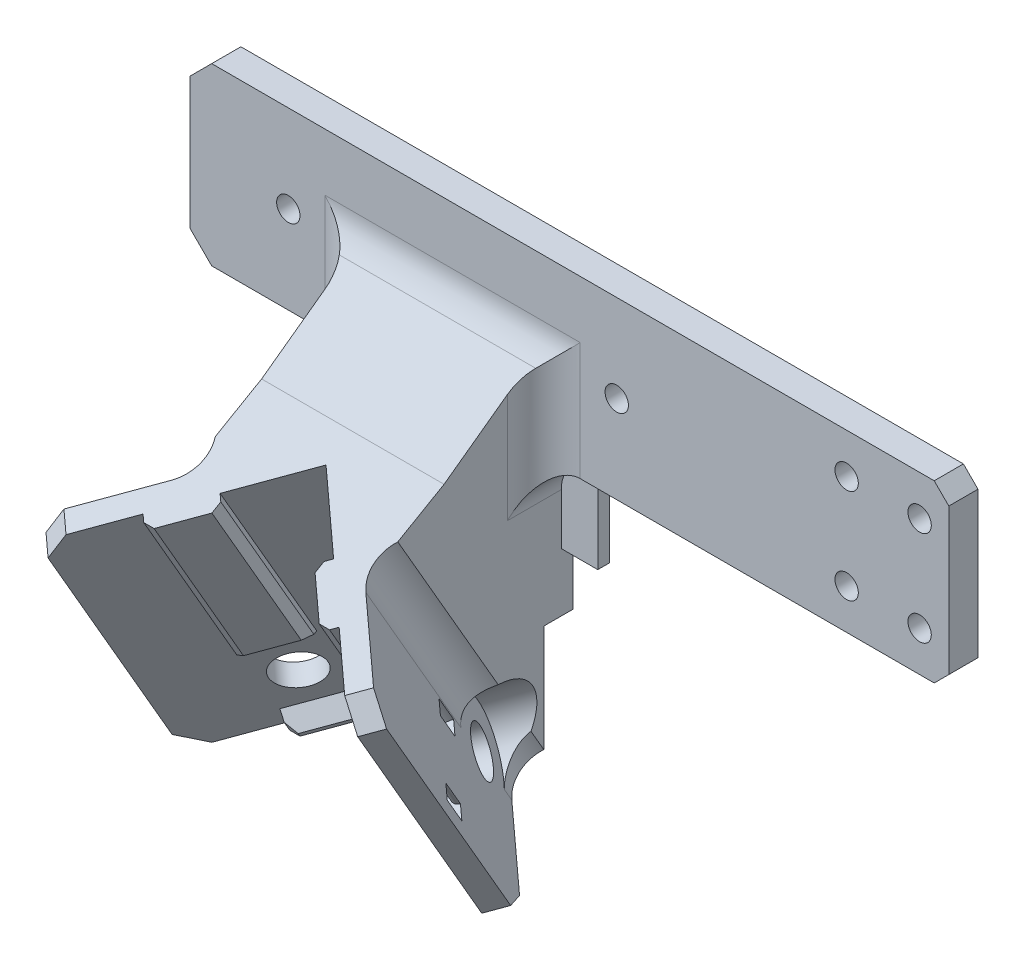
from build123d import *

# Parameters (mm, degrees)
CROQUIS1_R                   = 1.6
SALIENTE_EXTRUIR1_DEPTH      = 4
CROQUIS3_R                   = 1.6
SALIENTE_EXTRUIR3_DEPTH      = 4
SALIENTE_EXTRUIR4_DEPTH      = 10
SALIENTE_EXTRUIR4_DEPTH_BACK = 30
CROQUIS13_R                  = 3.1
CORTAR_EXTRUIR8_DEPTH        = 5
CORTAR_EXTRUIR9_DEPTH        = 2
CROQUIS15_R                  = 3.1
CORTAR_EXTRUIR10_DEPTH       = 5
CORTAR_EXTRUIR11_DEPTH       = 2
SALIENTE_EXTRUIR5_DEPTH      = 12.5
CORTAR_EXTRUIR12_DEPTH       = 97.942632989
REDONDEO1_R                  = 5
CHAFL_N1_SIZE                = 3
CROQUIS20_W                  = 35
CROQUIS20_H                  = 12
SALIENTE_EXTRUIR6_DEPTH      = 1.6
CORTAR_EXTRUIR13_START       = -16
CORTAR_EXTRUIR13_DEPTH       = 4
CORTAR_EXTRUIR14_DEPTH       = 1
CHAFL_N2_SIZE                = 1
CROQUIS26_R                  = 6
CORTAR_EXTRUIR15_DEPTH       = 97.990804498
CROQUIS27_R                  = 6
CORTAR_EXTRUIR16_DEPTH       = 83.219817158


with BuildPart() as part:
    # Croquis1 → Saliente-Extruir1 (new body)
    with BuildSketch(Plane.XY):
        Polygon((12.5, -12), (36, -12), (36, 12), (-36, 12), (-36, -12), (-12.5, -12), (-12.5, -32), (12.5, -32), align=None)
        with Locations((-22.5, 0)):
            Circle(CROQUIS1_R, mode=Mode.SUBTRACT)
        with Locations(Location((22.5, 0, 0), (0, 0, 180))):
            Circle(CROQUIS1_R, mode=Mode.SUBTRACT)
    extrude(amount=SALIENTE_EXTRUIR1_DEPTH)

    # Croquis3 → Saliente-Extruir3 (add)
    with BuildSketch(Plane(origin=(0, 0, 0), x_dir=(-1, 0, 0), z_dir=(0, 0, -1))):
        Polygon((-66, 12), (-36, 12), (-36, -12), (-66, -12), (-68, -10), (-68, 10), align=None)
        with Locations((-54, 6.5)):
            Circle(CROQUIS3_R, mode=Mode.SUBTRACT)
        with Locations((-64, 6.5)):
            Circle(CROQUIS3_R, mode=Mode.SUBTRACT)
        with Locations(Location((-54, -6.5, 0), (0, 0, 180))):
            Circle(CROQUIS3_R, mode=Mode.SUBTRACT)
        with Locations(Location((-64, -6.5, 0), (0, 0, 180))):
            Circle(CROQUIS3_R, mode=Mode.SUBTRACT)
    extrude(amount=-SALIENTE_EXTRUIR3_DEPTH)



with BuildPart() as body_2:
    # Croquis5 → Saliente-Extruir4 (new, two sides: drawn at the far end of the back side and taken through both)
    with BuildSketch(Plane(origin=(0, -7.410084816, -3.949966301), x_dir=(1, 0, 0), z_dir=(0, 0.8660254037844365, 0.500000000000004)).offset(-SALIENTE_EXTRUIR4_DEPTH_BACK)):
        Polygon((-13.435028843, -36.857499897), (-21.213203436, -44.63567449), (-23.334523779, -42.514354147), (0, -19.179830368), (23.334523779, -42.514354147), (21.213203436, -44.63567449), (13.435028843, -36.857499897), (12.02081528, -38.27171346), (6.363961031, -32.61485921), (7.778174593, -31.200645648), (0, -23.422471055), (-7.778174593, -31.200645648), (-6.363961031, -32.61485921), (-12.02081528, -38.27171346), align=None)
    extrude(amount=SALIENTE_EXTRUIR4_DEPTH + SALIENTE_EXTRUIR4_DEPTH_BACK)

    # Croquis13 → Cortar-Extruir8 (cut)
    with BuildSketch(Plane(origin=(-13.267584714, -6.633792357, 11.490065409), x_dir=(0.507803426331559, 0.348761974398733, 0.7877187095781251), z_dir=(-0.7071067811865643, -0.3535533905932681, 0.6123724356957784))):
        with Locations(Location((1.660616416, -43.929890843, 0), (0, 0, 338.10898766))):
            Circle(CROQUIS13_R)
    extrude(amount=-CORTAR_EXTRUIR8_DEPTH, mode=Mode.SUBTRACT)

    # Croquis14 → Cortar-Extruir9 (cut)
    with BuildSketch(Plane(origin=(-13.267584714, -6.633792357, 11.490065409), x_dir=(0.5078034263315588, 0.34876197439873297, 0.7877187095781252), z_dir=(-0.7071067811865644, -0.3535533905932682, 0.6123724356957784))):
        Polygon((-4.343485935, -44.377947721), (1.401654006, -49.945116397), (7.664718766, -43.481833965), (1.919578826, -37.914665289), align=None)
    extrude(amount=-CORTAR_EXTRUIR9_DEPTH, mode=Mode.SUBTRACT)

    # Croquis15 → Cortar-Extruir10 (cut)
    with BuildSketch(Plane(origin=(9.45623893, -4.016140699, 17.402330326), x_dir=(0.6987181482176081, 0.2163574800319091, -0.681896172584653), z_dir=(0.7071067811865643, -0.3535533905932682, 0.6123724356957785))):
        with Locations(Location((-20.590563159, -39.243181673, 0), (0, 0, 346.626622657))):
            Circle(CROQUIS15_R)
    extrude(amount=-CORTAR_EXTRUIR10_DEPTH, mode=Mode.SUBTRACT)

    # Croquis17 → Cortar-Extruir11 (cut)
    with BuildSketch(Plane(origin=(9.45623893, -4.016140699, 17.402330326), x_dir=(0.6987181482176101, 0.21635748003192523, -0.6818961725846459), z_dir=(0.7071067811865642, -0.3535533905932681, 0.6123724356957785))):
        Polygon((-23.85201333, -44.304104788), (-15.946919878, -43.07548869), (-17.329112988, -34.182258557), (-25.23420644, -35.410874655), align=None)
    extrude(amount=-CORTAR_EXTRUIR11_DEPTH, mode=Mode.SUBTRACT)


with BuildPart() as part_1:
    add(part.part)

    add(body_2.part)  # Saliente-Extruir5 merges body 2
    # Croquis19 → Saliente-Extruir5 (add, symmetric)
    with BuildSketch(Plane(origin=(0, 0, 0), x_dir=(0, 0, -1), z_dir=(1, 0, 0))):
        Polygon((-17.660254038, -8.339745962), (-24, -12), (-4, -46.641016151), (-4, 1.6), align=None)
    extrude(amount=SALIENTE_EXTRUIR5_DEPTH, both=True)

    # Croquis18 → Cortar-Extruir12 (cut, through all)
    with BuildSketch(Plane(origin=(0, 1.392304845, 0.803847577), x_dir=(1, 0, 0), z_dir=(0, 0.866025403784436, 0.5000000000000047))):
        Polygon((0, -23.706742302), (3.077867389, -26.784609691), (-3.077867389, -26.784609691), align=None)
    extrude(amount=-CORTAR_EXTRUIR12_DEPTH, mode=Mode.SUBTRACT)

    # Redondeo1
    # the kernel refuses this fillet: 5 mm, written as the material it adds along each edge
    with BuildSketch(Plane(origin=(-12.5, -12, 4), x_dir=(0, 0, 1), z_dir=(0, 1, 0))) as redondeo1_piece_1_section:
        with BuildLine():
            CenterArc((REDONDEO1_R, -REDONDEO1_R), REDONDEO1_R, 90, 90)
            Line((0, -REDONDEO1_R), (0, 0))
            Line((0, 0), (REDONDEO1_R, 0))
        make_face()
    redondeo1_piece_1 = extrude(amount=26.1, mode=Mode.PRIVATE)
    redondeo1_piece_1 = split(redondeo1_piece_1, bisect_by=Plane(origin=(-12.5, -3.107971775, 10.47019458), z_dir=(0, -0.8085948334948876, -0.5883658685251678)), keep=Keep.TOP, mode=Mode.PRIVATE)
    add(redondeo1_piece_1)
    with BuildSketch(Plane(origin=(12.5, -12, 4), x_dir=(1, 0, 0), z_dir=(0, 1, 0))) as redondeo1_piece_2_section:
        with BuildLine():
            CenterArc((REDONDEO1_R, -REDONDEO1_R), REDONDEO1_R, 90, 90)
            Line((0, -REDONDEO1_R), (0, 0))
            Line((0, 0), (REDONDEO1_R, 0))
        make_face()
    redondeo1_piece_2 = extrude(amount=26.1, mode=Mode.PRIVATE)
    redondeo1_piece_2 = split(redondeo1_piece_2, bisect_by=Plane(origin=(12.5, -3.107971775, 10.47019458), z_dir=(0, -0.8085948334948876, -0.5883658685251678)), keep=Keep.TOP, mode=Mode.PRIVATE)
    add(redondeo1_piece_2)
    with BuildSketch(Plane(origin=(7.320508076, -12, 24), x_dir=(1, 0, 0), z_dir=(4.317754261380365e-15, -0.8660254037844386, -0.5000000000000003))) as redondeo1_piece_3_section:
        with BuildLine():
            CenterArc((9.531962296, 2.460894484), REDONDEO1_R, 135, 74.483895024)
            Line((5.99642839, 5.99642839), (0, 0))
            Line((0, 0), (5.179491924, 0))
        make_face()
    redondeo1_piece_3 = extrude(amount=40, mode=Mode.PRIVATE)
    redondeo1_piece_3 = redondeo1_piece_3 - Plane(origin=(12.727922061, -42.416519914, 12.68295788), x_dir=(0.6546536707086608, -2.4580337765200966e-12, 0.7559289460178625), z_dir=(-0.7071067811865643, -0.3535533905932682, 0.6123724356957785)) * Cylinder(3.1, 104, mode=Mode.PRIVATE)
    add(redondeo1_piece_3)
    with BuildSketch(Plane(origin=(-7.320508076, -46.641016151, 4), x_dir=(-0.7071067811865446, -0.35355339059327284, 0.6123724356957984), z_dir=(4.160745015511988e-15, 0.8660254037844385, 0.5000000000000003))) as redondeo1_piece_4_section:
        with BuildLine():
            CenterArc((8.480230355, -5), REDONDEO1_R, 90, 74.483895024)
            Line((3.662453863, -3.662453863), (0, 0))
            Line((0, 0), (8.480230355, 0))
        make_face()
    redondeo1_piece_4 = extrude(amount=40, mode=Mode.PRIVATE)
    redondeo1_piece_4 = redondeo1_piece_4 - Plane(origin=(-12.727922061, -42.416519914, 12.68295788), x_dir=(0.6546536707075166, -1.5466516956053056e-12, -0.7559289460188534), z_dir=(0.7071067811865643, -0.3535533905932681, 0.6123724356957784)) * Cylinder(3.1, 114, mode=Mode.PRIVATE)
    add(redondeo1_piece_4)
    with BuildSketch(Plane(origin=(-12.5, -12, 0), x_dir=(0, -1, 0), z_dir=(0, 0, 1)), Plane(origin=(12.5, -12, 0), x_dir=(1, 0, 0), z_dir=(0, 0, 1))) as redondeo1_piece_5:
        with BuildLine():
            CenterArc((REDONDEO1_R, -REDONDEO1_R), REDONDEO1_R, 90, 90)
            Line((0, -REDONDEO1_R), (0, 0))
            Line((0, 0), (REDONDEO1_R, 0))
        make_face()
    extrude(amount=4)
    with BuildSketch(Plane(origin=(12.5, 1.6, 4), x_dir=(0, -0.5883658685251676, 0.8085948334948878), z_dir=(-1, 0, 0))) as redondeo1_piece_6:
        with BuildLine():
            CenterArc((REDONDEO1_R * 0.509073412819, REDONDEO1_R), REDONDEO1_R, 216.04113083, 53.95886917)
            Line((-REDONDEO1_R * 0.299521420676, REDONDEO1_R * 0.411634131475), (0, 0))
            Line((0, 0), (REDONDEO1_R * 0.509073412819, 0))
        make_face()
    extrude(amount=25)
    with BuildSketch(Plane(origin=(-12.5, -12, 0), x_dir=(0, -1, 0), z_dir=(0, 0, 1))) as redondeo1_piece_7a_section:
        with BuildLine():
            CenterArc((REDONDEO1_R, -REDONDEO1_R), REDONDEO1_R, 90, 90)
            Line((0, -REDONDEO1_R), (0, 0))
            Line((0, 0), (REDONDEO1_R, 0))
        make_face()
    redondeo1_piece_7a = extrude(amount=16.5, mode=Mode.PRIVATE)
    redondeo1_piece_7a = split(redondeo1_piece_7a, bisect_by=Plane(origin=(-12.5, -12, 4), z_dir=(0, 0, 1)), keep=Keep.TOP, mode=Mode.PRIVATE)
    with BuildSketch(Plane(origin=(-12.5, -24.5, 4), x_dir=(0, 0, 1), z_dir=(0, 1, 0))) as redondeo1_piece_7b_section:
        with BuildLine():
            CenterArc((REDONDEO1_R, -REDONDEO1_R), REDONDEO1_R, 90, 90)
            Line((0, -REDONDEO1_R), (0, 0))
            Line((0, 0), (REDONDEO1_R, 0))
        make_face()
    redondeo1_piece_7b = extrude(amount=38.6, mode=Mode.PRIVATE)
    redondeo1_piece_7b = split(redondeo1_piece_7b, bisect_by=Plane(origin=(-12.5, -12, 4), z_dir=(0, -1, 0)), keep=Keep.TOP, mode=Mode.PRIVATE)
    redondeo1_piece_7 = redondeo1_piece_7a & redondeo1_piece_7b
    add(redondeo1_piece_7)
    with BuildSketch(Plane(origin=(12.5, 1.6, 4), x_dir=(0, -0.5883658685251676, 0.8085948334948878), z_dir=(-1, 0, 0))) as redondeo1_piece_8a_section:
        with BuildLine():
            CenterArc((REDONDEO1_R * 0.509073412819, REDONDEO1_R), REDONDEO1_R, 216.04113083, 53.95886917)
            Line((-REDONDEO1_R * 0.299521420676, REDONDEO1_R * 0.411634131475), (0, 0))
            Line((0, 0), (REDONDEO1_R * 0.509073412819, 0))
        make_face()
    redondeo1_piece_8a = extrude(amount=31.36341766, mode=Mode.PRIVATE)
    redondeo1_piece_8a = split(redondeo1_piece_8a, bisect_by=Plane(origin=(-12.5, 1.6, 4), z_dir=(-1, 0, 0)), keep=Keep.TOP, mode=Mode.PRIVATE)
    with BuildSketch(Plane(origin=(-12.5, -12, 4), x_dir=(0, 0, 1), z_dir=(0, 1, 0))) as redondeo1_piece_8b_section:
        with BuildLine():
            CenterArc((REDONDEO1_R, -REDONDEO1_R), REDONDEO1_R, 90, 90)
            Line((0, -REDONDEO1_R), (0, 0))
            Line((0, 0), (REDONDEO1_R, 0))
        make_face()
    redondeo1_piece_8b = extrude(amount=26.1, mode=Mode.PRIVATE)
    redondeo1_piece_8b = split(redondeo1_piece_8b, bisect_by=Plane(origin=(-12.5, -3.107971775, 10.47019458), z_dir=(0, 0.8085948334948876, 0.5883658685251678)), keep=Keep.TOP, mode=Mode.PRIVATE)
    redondeo1_piece_8b = split(redondeo1_piece_8b, bisect_by=Plane(origin=(-12.5, 12, 4), z_dir=(0, -1, 0)), keep=Keep.TOP, mode=Mode.PRIVATE)
    redondeo1_piece_8 = redondeo1_piece_8a & redondeo1_piece_8b
    add(redondeo1_piece_8)
    with BuildSketch(Plane(origin=(12.5, -12, 0), x_dir=(1, 0, 0), z_dir=(0, 0, 1))) as redondeo1_piece_9a_section:
        with BuildLine():
            CenterArc((REDONDEO1_R, -REDONDEO1_R), REDONDEO1_R, 90, 90)
            Line((0, -REDONDEO1_R), (0, 0))
            Line((0, 0), (REDONDEO1_R, 0))
        make_face()
    redondeo1_piece_9a = extrude(amount=16.5, mode=Mode.PRIVATE)
    redondeo1_piece_9a = split(redondeo1_piece_9a, bisect_by=Plane(origin=(12.5, -12, 4), z_dir=(0, 0, 1)), keep=Keep.TOP, mode=Mode.PRIVATE)
    with BuildSketch(Plane(origin=(12.5, -24.5, 4), x_dir=(1, 0, 0), z_dir=(0, 1, 0))) as redondeo1_piece_9b_section:
        with BuildLine():
            CenterArc((REDONDEO1_R, -REDONDEO1_R), REDONDEO1_R, 90, 90)
            Line((0, -REDONDEO1_R), (0, 0))
            Line((0, 0), (REDONDEO1_R, 0))
        make_face()
    redondeo1_piece_9b = extrude(amount=38.6, mode=Mode.PRIVATE)
    redondeo1_piece_9b = split(redondeo1_piece_9b, bisect_by=Plane(origin=(12.5, -12, 4), z_dir=(0, -1, 0)), keep=Keep.TOP, mode=Mode.PRIVATE)
    redondeo1_piece_9 = redondeo1_piece_9a & redondeo1_piece_9b
    add(redondeo1_piece_9)
    with BuildSketch(Plane(origin=(18.86341766, 1.6, 4), x_dir=(0, -0.5883658685251676, 0.8085948334948878), z_dir=(-1, 0, 0))) as redondeo1_piece_10a_section:
        with BuildLine():
            CenterArc((REDONDEO1_R * 0.509073412819, REDONDEO1_R), REDONDEO1_R, 216.04113083, 53.95886917)
            Line((-REDONDEO1_R * 0.299521420676, REDONDEO1_R * 0.411634131475), (0, 0))
            Line((0, 0), (REDONDEO1_R * 0.509073412819, 0))
        make_face()
    redondeo1_piece_10a = extrude(amount=31.36341766, mode=Mode.PRIVATE)
    redondeo1_piece_10a = split(redondeo1_piece_10a, bisect_by=Plane(origin=(12.5, 1.6, 4), z_dir=(1, 0, 0)), keep=Keep.TOP, mode=Mode.PRIVATE)
    with BuildSketch(Plane(origin=(12.5, -12, 4), x_dir=(1, 0, 0), z_dir=(0, 1, 0))) as redondeo1_piece_10b_section:
        with BuildLine():
            CenterArc((REDONDEO1_R, -REDONDEO1_R), REDONDEO1_R, 90, 90)
            Line((0, -REDONDEO1_R), (0, 0))
            Line((0, 0), (REDONDEO1_R, 0))
        make_face()
    redondeo1_piece_10b = extrude(amount=26.1, mode=Mode.PRIVATE)
    redondeo1_piece_10b = split(redondeo1_piece_10b, bisect_by=Plane(origin=(12.5, -3.107971775, 10.47019458), z_dir=(0, 0.8085948334948876, 0.5883658685251678)), keep=Keep.TOP, mode=Mode.PRIVATE)
    redondeo1_piece_10b = split(redondeo1_piece_10b, bisect_by=Plane(origin=(12.5, 12, 4), z_dir=(0, -1, 0)), keep=Keep.TOP, mode=Mode.PRIVATE)
    redondeo1_piece_10 = redondeo1_piece_10a & redondeo1_piece_10b
    add(redondeo1_piece_10)

    # Chaflán1
    # the kernel refuses this chamfer: 3 mm, written as the material it takes off along each edge
    with BuildSketch(Plane(origin=(28.789887219, -51.920342283, 13.14406109), x_dir=(-0.7071067811865452, 0.3535533905922682, -0.6123724356963777), z_dir=(-0.7071067811865499, -0.3535533905932755, 0.612372435695791)), Plane(origin=(28.789887219, -17.279326132, 33.14406109), x_dir=(0, -0.8660254037844364, -0.5000000000000038), z_dir=(-0.7071067811865499, -0.3535533905932755, 0.612372435695791)), Plane(origin=(-15.757839996, -58.436365895, 24.430145048), x_dir=(0.7071067811865446, 0.35355339059226804, -0.6123724356963787), z_dir=(-0.7071067811865506, 0.35355339059327506, -0.6123724356957905)), Plane(origin=(-15.757839996, -23.795349743, 44.430145048), x_dir=(1.0187338616200341e-15, -0.8660254037844359, -0.5000000000000048), z_dir=(-0.7071067811865506, 0.35355339059327506, -0.6123724356957905))) as chafl_n1_piece_1:
        Polygon((CHAFL_N1_SIZE, 0), (0, -CHAFL_N1_SIZE), (0, 0), align=None)
    extrude(amount=18.430097928, mode=Mode.SUBTRACT)
    with BuildSketch(Plane(origin=(-36, -12, -7.715048964), x_dir=(1, 0, 0), z_dir=(0, 0, 1)), Plane(origin=(-36, 12, -7.715048964), x_dir=(0, -1, 0), z_dir=(0, 0, 1))) as chafl_n1_piece_2:
        Polygon((CHAFL_N1_SIZE, 0), (0, CHAFL_N1_SIZE), (0, 0), align=None)
    extrude(amount=19.430097928, mode=Mode.SUBTRACT)
    with BuildSketch(Plane(origin=(17.47617872, -44.429067832, 25.168793127), x_dir=(-6.759924317340777e-14, 0.8660254037844032, 0.5000000000000615), z_dir=(-0.7071067811865307, 0.35355339059328433, -0.612372435695808))) as chafl_n1_piece_3_section:
        Polygon((CHAFL_N1_SIZE, 0), (0, CHAFL_N1_SIZE), (0, 0), align=None)
    chafl_n1_piece_3 = extrude(amount=23.430097928, mode=Mode.PRIVATE)
    chafl_n1_piece_3 = split(chafl_n1_piece_3, bisect_by=Plane(origin=(18.890392282, -43.721961051, 23.944048256), z_dir=(-0.7071067811865624, -0.3535533905932693, 0.6123724356957801)), keep=Keep.TOP, mode=Mode.PRIVATE)
    add(chafl_n1_piece_3, mode=Mode.SUBTRACT)
    with BuildSketch(Plane(origin=(-0.908597591, -36.145277268, 10.820846991), x_dir=(-6.423188959645292e-14, 0.8660254037844686, 0.4999999999999479), z_dir=(-0.7071067811865309, -0.35355339059328467, 0.6123724356958076))) as chafl_n1_piece_4_section:
        Polygon((CHAFL_N1_SIZE, 0), (0, CHAFL_N1_SIZE), (0, 0), align=None)
    chafl_n1_piece_4 = extrude(amount=23.430097928, mode=Mode.PRIVATE)
    chafl_n1_piece_4 = split(chafl_n1_piece_4, bisect_by=Plane(origin=(-2.322811153, -35.438170487, 9.596102119), z_dir=(0.7071067811865481, -0.3535533905932773, 0.6123724356957921)), keep=Keep.TOP, mode=Mode.PRIVATE)
    add(chafl_n1_piece_4, mode=Mode.SUBTRACT)
    with BuildSketch(Plane(origin=(-17.47617872, -52.223296466, 20.668793127), x_dir=(-0.7071067811865641, 0.35355339059326935, -0.6123724356957778), z_dir=(0.7071067811865309, 0.35355339059328544, -0.6123724356958071))) as chafl_n1_piece_5_section:
        Polygon((CHAFL_N1_SIZE, 0), (0, -CHAFL_N1_SIZE), (0, 0), align=None)
    chafl_n1_piece_5 = extrude(amount=23.430097928, mode=Mode.PRIVATE)
    chafl_n1_piece_5 = split(chafl_n1_piece_5, bisect_by=Plane(origin=(-18.890392282, -51.516189685, 19.444048256), z_dir=(0.7071067811865481, -0.3535533905932773, 0.6123724356957921)), keep=Keep.TOP, mode=Mode.PRIVATE)
    add(chafl_n1_piece_5, mode=Mode.SUBTRACT)
    with BuildSketch(Plane(origin=(0.908597591, -43.939505902, 6.320846991), x_dir=(0.7071067811865644, 0.35355339059326846, -0.612372435695778), z_dir=(0.7071067811865307, -0.35355339059328506, 0.6123724356958077))) as chafl_n1_piece_6_section:
        Polygon((CHAFL_N1_SIZE, 0), (0, -CHAFL_N1_SIZE), (0, 0), align=None)
    chafl_n1_piece_6 = extrude(amount=23.430097928, mode=Mode.PRIVATE)
    chafl_n1_piece_6 = split(chafl_n1_piece_6, bisect_by=Plane(origin=(2.322811153, -43.232399121, 5.096102119), z_dir=(-0.7071067811865624, -0.3535533905932693, 0.6123724356957801)), keep=Keep.TOP, mode=Mode.PRIVATE)
    add(chafl_n1_piece_6, mode=Mode.SUBTRACT)

    # Croquis20 → Saliente-Extruir6 (add)
    with BuildSketch(Plane(origin=(0, 0, 0), x_dir=(-1, 0, 0), z_dir=(0, 0, -1))):
        with Locations((0, -18)):
            Rectangle(CROQUIS20_W, CROQUIS20_H)
    extrude(amount=-SALIENTE_EXTRUIR6_DEPTH)

    # Croquis23 → Cortar-Extruir13 (cut)
    with BuildSketch(Plane(origin=(0, -33.248711306, -19.196152423), x_dir=(1, 0, 0), z_dir=(0, -0.866025403784436, -0.5000000000000047)).offset(CORTAR_EXTRUIR13_START)):
        with BuildLine():
            Line((14.919953083, 35.798268261), (19.091883092, 39.97019827))
            ThreePointArc((19.091883092, 39.97019827), (19.798989873, 40.263091488), (20.506096654, 39.97019827))
            Line((20.506096654, 39.97019827), (21.920310217, 41.384411832))
            ThreePointArc((21.920310217, 41.384411832), (19.798989873, 42.263091488), (17.67766953, 41.384411832))
            Line((17.67766953, 41.384411832), (13.505739521, 37.212481823))
            ThreePointArc((13.505739521, 37.212481823), (12.627059864, 35.091161479), (13.505739521, 32.969841136))
            Line((13.505739521, 32.969841136), (14.919953083, 34.384054698))
            ThreePointArc((14.919953083, 34.384054698), (14.627059864, 35.091161479), (14.919953083, 35.798268261))
        make_face()
    extrude(amount=-CORTAR_EXTRUIR13_DEPTH, mode=Mode.SUBTRACT)

    # Croquis25 → Cortar-Extruir14 (cut)
    # profile 1 of 2: a face of its own
    with BuildSketch(Plane(origin=(0, 0, 0), x_dir=(-1, 0, 0), z_dir=(0, 0, -1))):
        with BuildLine():
            Line((6.515886182, -27.504302408), (6.201783618, -27.504302408))
            add(Edge.make_bspline(
                [(6.201783618, -27.504302408), (6.210293169, -27.469069924), (6.226928644, -27.400193299), (6.261626218, -27.301786038), (6.299425473, -27.208662517), (6.344814577, -27.122566443), (6.394323332, -27.041767541), (6.451046053, -26.968098416), (6.512365776, -26.899685451), (6.580190725, -26.838972213), (6.651319387, -26.783994484), (6.726754007, -26.737119427), (6.8049769, -26.696795274), (6.886530033, -26.663575042), (6.971656205, -26.638549518), (7.059585828, -26.620392713), (7.150549328, -26.608601598), (7.212296919, -26.607450835), (7.243650605, -26.60686651)],
                knots=[0, 0, 0, 0, 1.162005537, 2.271625781, 3.343758855, 4.383309926, 5.390229558, 6.379919256, 7.361854164, 8.333198761, 9.295911338, 10.242430842, 11.177959212, 12.116337295, 13.062827104, 14.020064771, 14.994644689, 16, 16, 16, 16], degree=3))
            add(Edge.make_bspline(
                [(7.243650605, -26.60686651), (7.289333347, -26.60824574), (7.379702358, -26.610974116), (7.512465405, -26.635888552), (7.640492224, -26.675313685), (7.762381472, -26.729787412), (7.875599905, -26.796974725), (7.976336091, -26.876939462), (8.063224602, -26.968138763), (8.13611898, -27.068871328), (8.193193979, -27.176526837), (8.235280352, -27.287326994), (8.260902033, -27.401008966), (8.26422259, -27.477766245), (8.265886182, -27.516221478)],
                knots=[0, 0, 0, 0, 1.083050992, 2.142477498, 3.193116406, 4.255571735, 5.30263384, 6.308962982, 7.297363603, 8.282367274, 9.249857812, 10.179914175, 11.08814088, 12, 12, 12, 12], degree=3))
            add(Edge.make_bspline(
                [(8.265886182, -27.516221478), (8.264722591, -27.553228273), (8.262445624, -27.625644827), (8.243111918, -27.731366324), (8.210575656, -27.831007925), (8.165505893, -27.924989087), (8.107164343, -28.012713927), (8.036491646, -28.094379817), (7.952988984, -28.170348976), (7.889710046, -28.213868449), (7.857132176, -28.236273561)],
                knots=[0, 0, 0, 0, 1.024540389, 2.004866551, 2.965041327, 3.920577974, 4.882998113, 5.874504559, 6.905732034, 8, 8, 8, 8], degree=3))
            add(Edge.make_bspline(
                [(7.857132176, -28.236273561), (7.89436393, -28.254251733), (7.968130805, -28.289871691), (8.068681334, -28.359727448), (8.159959209, -28.440383795), (8.210862928, -28.503326448), (8.236439067, -28.534951446)],
                knots=[0, 0, 0, 0, 1.015518401, 2.012035669, 3.001164323, 4, 4, 4, 4], degree=3))
            add(Edge.make_bspline(
                [(8.236439067, -28.534951446), (8.253280409, -28.558009198), (8.286687305, -28.603747114), (8.327922839, -28.67728354), (8.365331953, -28.751635029), (8.394482173, -28.828794435), (8.417056039, -28.907867449), (8.433192072, -28.988989845), (8.443216212, -29.072227868), (8.444651765, -29.128540348), (8.445373362, -29.156846478)],
                knots=[0, 0, 0, 0, 1.025084078, 2.033381695, 3.024893161, 4.013698104, 4.991890475, 5.976764909, 6.982997093, 8, 8, 8, 8], degree=3))
            add(Edge.make_bspline(
                [(8.445373362, -29.156846478), (8.443578848, -29.205856199), (8.439998266, -29.303645001), (8.407994192, -29.448119723), (8.358380951, -29.589345225), (8.287924015, -29.724420064), (8.202056506, -29.850800445), (8.099899182, -29.963876754), (7.982612774, -30.061075359), (7.851807125, -30.142285587), (7.710089996, -30.207203509), (7.558514404, -30.252260952), (7.39926435, -30.281606951), (7.290057053, -30.28475382), (7.234536022, -30.28635369)],
                knots=[0, 0, 0, 0, 0.955779014, 1.907060117, 2.875433937, 3.871313158, 4.872415639, 5.851225146, 6.836215519, 7.83643374, 8.849228613, 9.86973379, 10.916971861, 12, 12, 12, 12], degree=3))
            add(Edge.make_bspline(
                [(7.234536022, -30.28635369), (7.197116722, -30.285485476), (7.123488017, -30.283777122), (7.015244518, -30.272098521), (6.911922819, -30.250768516), (6.813383221, -30.22206521), (6.719538185, -30.185673468), (6.630674079, -30.14035477), (6.546244186, -30.087043268), (6.467045235, -30.02510968), (6.393086667, -29.955828341), (6.326333943, -29.877969331), (6.26567415, -29.792971927), (6.212731511, -29.699848871), (6.165094558, -29.599803613), (6.125913602, -29.491555115), (6.091428033, -29.376071093), (6.075394569, -29.295593353), (6.067168233, -29.254302408)],
                knots=[0, 0, 0, 0, 1.048658725, 2.063410685, 3.046034179, 4.001477787, 4.936774919, 5.862367409, 6.792675028, 7.730719943, 8.675894397, 9.627829632, 10.600096036, 11.597688215, 12.626045268, 13.701542398, 14.82072376, 16, 16, 16, 16], degree=3))
            Line((6.067168233, -29.254302408), (6.381270798, -29.254302408))
            add(Edge.make_bspline(
                [(6.381270798, -29.254302408), (6.389454089, -29.281251421), (6.405371302, -29.333669592), (6.4324656, -29.409109898), (6.463333872, -29.478267951), (6.49644843, -29.541651073), (6.531226876, -29.599883476), (6.570141802, -29.651425345), (6.610310947, -29.698540547), (6.6405903, -29.725085159), (6.655409419, -29.738076446)],
                knots=[0, 0, 0, 0, 1.198163088, 2.33053128, 3.407730985, 4.417276592, 5.372219308, 6.28897303, 7.162600585, 8, 8, 8, 8], degree=3))
            add(Edge.make_bspline(
                [(6.655409419, -29.738076446), (6.675005996, -29.75318478), (6.714138659, -29.783354812), (6.77790689, -29.82185644), (6.844971776, -29.855217466), (6.91678645, -29.880701161), (6.991801221, -29.902278822), (7.071228586, -29.916399341), (7.154367803, -29.926087513), (7.211135566, -29.926942444), (7.240144996, -29.927379331)],
                knots=[0, 0, 0, 0, 0.946170439, 1.889420265, 2.845303464, 3.807233317, 4.801018734, 5.828864929, 6.890507805, 8, 8, 8, 8], degree=3))
            add(Edge.make_bspline(
                [(7.240144996, -29.927379331), (7.272898499, -29.926763425), (7.336945146, -29.925559076), (7.430400005, -29.914483369), (7.519307453, -29.898352956), (7.602680378, -29.873439973), (7.681610886, -29.842659121), (7.754992535, -29.804010716), (7.823788642, -29.758665994), (7.887118047, -29.707126836), (7.944063555, -29.650705341), (7.994203068, -29.591692269), (8.036827729, -29.53033644), (8.071211307, -29.466298319), (8.098361858, -29.39984309), (8.116845058, -29.330784261), (8.129696573, -29.259686995), (8.130743186, -29.211358026), (8.131270798, -29.186994715)],
                knots=[0, 0, 0, 0, 1.217147791, 2.380027433, 3.494444702, 4.572153297, 5.609568379, 6.639424714, 7.649109417, 8.668170816, 9.669597737, 10.625200337, 11.543417969, 12.441394052, 13.322311151, 14.205496177, 15.095365482, 16, 16, 16, 16], degree=3))
            add(Edge.make_bspline(
                [(8.131270798, -29.186994715), (8.129740496, -29.154383376), (8.126687507, -29.089322968), (8.103378928, -28.993605394), (8.065040064, -28.901381981), (8.011367553, -28.814226191), (7.946031824, -28.73345029), (7.869666917, -28.661378807), (7.781638689, -28.601908716), (7.70061882, -28.56082006), (7.628853663, -28.532782985), (7.567438279, -28.51410802), (7.498681675, -28.498294365), (7.423415326, -28.483582093), (7.34107211, -28.471060745), (7.251741672, -28.460618929), (7.15540591, -28.452263888), (7.088714745, -28.448532793), (7.054347721, -28.4466101)],
                knots=[0, 0, 0, 0, 1.07054697, 2.135767047, 3.216561865, 4.33974944, 5.486079747, 6.621378074, 7.775625952, 8.963672916, 9.598146892, 10.304877434, 11.070270905, 11.915000392, 12.823868403, 13.805723172, 14.86925407, 16, 16, 16, 16], degree=3))
            Line((7.054347721, -28.4466101), (7.054347721, -28.087635741))
            add(Edge.make_bspline(
                [(7.054347721, -28.087635741), (7.097648886, -28.086900937), (7.182465233, -28.085461637), (7.306359538, -28.068053627), (7.42483285, -28.043972999), (7.535259592, -28.007087806), (7.635908305, -27.96424751), (7.723227907, -27.9143953), (7.795995054, -27.858980551), (7.853856126, -27.797147942), (7.897385355, -27.730832894), (7.929212152, -27.661716236), (7.948012478, -27.589192175), (7.950522145, -27.539697507), (7.951783618, -27.514819235)],
                knots=[0, 0, 0, 0, 1.321986639, 2.589447074, 3.816329219, 5.01088745, 6.139805852, 7.153945165, 8.075214402, 8.924034688, 9.728124013, 10.488707548, 11.240355623, 12, 12, 12, 12], degree=3))
            add(Edge.make_bspline(
                [(7.951783618, -27.514819235), (7.951369207, -27.496541489), (7.950544756, -27.460178782), (7.940147478, -27.407053714), (7.924523437, -27.355552768), (7.903043708, -27.305894957), (7.874293509, -27.258424683), (7.839887523, -27.212737235), (7.798919423, -27.169093456), (7.751973976, -27.128413136), (7.701562171, -27.089643899), (7.646312395, -27.056730262), (7.587890521, -27.0285852), (7.526231866, -27.005375698), (7.461136336, -26.987916409), (7.392909778, -26.975380568), (7.321422094, -26.967542913), (7.272650362, -26.966414497), (7.247857336, -26.965840869)],
                knots=[0, 0, 0, 0, 0.884392785, 1.759457502, 2.611959086, 3.489218968, 4.37281399, 5.2945488, 6.255912374, 7.266815255, 8.301784654, 9.332968512, 10.37626691, 11.440494194, 12.520033166, 13.637162961, 14.798855837, 16, 16, 16, 16], degree=3))
            add(Edge.make_bspline(
                [(7.247857336, -26.965840869), (7.208005668, -26.967232231), (7.130166092, -26.969949885), (7.017951175, -26.993752898), (6.913631841, -27.031730982), (6.833893174, -27.077064001), (6.7750106, -27.121814435), (6.732933662, -27.160896821), (6.691613151, -27.204329645), (6.653767474, -27.25478802), (6.615493498, -27.30885481), (6.580648936, -27.369278492), (6.546789244, -27.434482886), (6.526386694, -27.480578521), (6.515886182, -27.504302408)],
                knots=[0, 0, 0, 0, 1.472543308, 2.876219568, 4.221790263, 5.565193594, 6.249813518, 6.953379497, 7.687249741, 8.463570142, 9.283606569, 10.136032583, 11.040678096, 12, 12, 12, 12], degree=3))
        make_face()
    # profile 2 of 2: a face of its own
    with BuildSketch(Plane(origin=(0, 0, 0), x_dir=(-1, 0, 0), z_dir=(0, 0, -1))):
        with BuildLine():
            add(Edge.make_bspline(
                [(8.759475926, -28.448012343), (8.759803944, -28.391914956), (8.760441124, -28.282944971), (8.767529545, -28.124160329), (8.779304887, -27.97520004), (8.79544226, -27.836056974), (8.81508024, -27.70669521), (8.841295727, -27.587460453), (8.871108529, -27.477800846), (8.905660975, -27.377358798), (8.944648764, -27.284781095), (8.987083025, -27.198355893), (9.034647819, -27.118213961), (9.084624732, -27.043076171), (9.139036804, -26.974172476), (9.196335594, -26.910529813), (9.258757471, -26.853619063), (9.324180479, -26.80177276), (9.393196943, -26.756323289), (9.463839609, -26.71629055), (9.536594715, -26.682090683), (9.611660898, -26.655200247), (9.688363456, -26.6329894), (9.766970523, -26.617800453), (9.847611887, -26.608243544), (9.902043322, -26.607329876), (9.929648201, -26.60686651)],
                knots=[0, 0, 0, 0, 1.646270934, 3.197905019, 4.663502075, 6.030701355, 7.308322542, 8.50163776, 9.611534131, 10.641858119, 11.616356847, 12.558055219, 13.465016945, 14.349605745, 15.204443733, 16.039544428, 16.859896111, 17.680448484, 18.487036065, 19.28249412, 20.06191084, 20.843045899, 21.620316918, 22.403196591, 23.190181807, 24, 24, 24, 24], degree=3))
            add(Edge.make_bspline(
                [(9.929648201, -26.60686651), (9.95748368, -26.607354325), (10.012839689, -26.608324436), (10.094680064, -26.617648379), (10.174629746, -26.633119502), (10.252347884, -26.655040476), (10.328472871, -26.682236153), (10.402409279, -26.71632327), (10.47461636, -26.756002138), (10.543946648, -26.802626015), (10.611161263, -26.854608291), (10.674609226, -26.91337096), (10.734296312, -26.978320679), (10.790971617, -27.048762543), (10.843027214, -27.126047628), (10.892600647, -27.208831738), (10.936972683, -27.298562602), (10.979707358, -27.39374307), (11.016594345, -27.497006729), (11.04986059, -27.60777149), (11.076739558, -27.727345676), (11.099128831, -27.855101922), (11.116473727, -27.991509405), (11.129106369, -28.136275721), (11.135779454, -28.289496111), (11.137036155, -28.39425396), (11.137681054, -28.448012343)],
                knots=[0, 0, 0, 0, 0.810914788, 1.612654377, 2.396697861, 3.181598691, 3.963628158, 4.749916497, 5.551656086, 6.361998678, 7.18212741, 8.025565596, 8.878627764, 9.750805457, 10.657531673, 11.591944965, 12.560506719, 13.57287815, 14.630710178, 15.753379473, 16.941251878, 18.199788006, 19.531962791, 20.947069417, 22.433333509, 24, 24, 24, 24], degree=3))
            add(Edge.make_bspline(
                [(11.137681054, -28.448012343), (11.137029469, -28.501536251), (11.135759883, -28.605825403), (11.129181177, -28.758356379), (11.116222546, -28.902354422), (11.100012557, -29.038164884), (11.077561594, -29.165222503), (11.049956428, -29.283966952), (11.019306105, -29.394911023), (10.981471311, -29.497145835), (10.940060601, -29.592097558), (10.895005405, -29.680764706), (10.846735578, -29.763930999), (10.794146833, -29.840930746), (10.73809342, -29.912309403), (10.677375631, -29.976807025), (10.613705046, -30.035977697), (10.546292631, -30.088629325), (10.475881079, -30.13471413), (10.403922002, -30.17592798), (10.329138619, -30.209160675), (10.253225666, -30.237695716), (10.1750973, -30.259496168), (10.094850909, -30.274570023), (10.012894674, -30.285141872), (9.957493108, -30.285948352), (9.929648201, -30.28635369)],
                knots=[0, 0, 0, 0, 1.561518951, 3.042555995, 4.452378317, 5.7783523, 7.031515105, 8.214008947, 9.334062868, 10.386615937, 11.391082383, 12.354592575, 13.286541444, 14.194233754, 15.072674879, 15.931287219, 16.775624067, 17.606195743, 18.42308326, 19.229000347, 20.022332153, 20.807536673, 21.593273796, 22.3848459, 23.188221202, 24, 24, 24, 24], degree=3))
            add(Edge.make_bspline(
                [(9.929648201, -30.28635369), (9.902044087, -30.285887334), (9.847614163, -30.284967772), (9.766961737, -30.275454041), (9.688679294, -30.260158538), (9.61238054, -30.238741933), (9.537674025, -30.212527097), (9.465577738, -30.178373414), (9.395290054, -30.139039345), (9.326998498, -30.094243923), (9.261986337, -30.04292224), (9.199887732, -29.986157951), (9.142262713, -29.92253454), (9.088628617, -29.853056617), (9.037654529, -29.778363375), (8.990765156, -29.697435002), (8.947394302, -29.610592391), (8.907750811, -29.51727448), (8.872602147, -29.416119553), (8.841554439, -29.305970374), (8.817040282, -29.185854738), (8.796057326, -29.056737371), (8.779132943, -28.91806344), (8.767578618, -28.769757662), (8.760437303, -28.611912453), (8.759802233, -28.503642679), (8.759475926, -28.448012343)],
                knots=[0, 0, 0, 0, 0.810891512, 1.598919785, 2.382837074, 3.152667961, 3.926044502, 4.706494248, 5.493654104, 6.291793342, 7.103789334, 7.925228297, 8.761435821, 9.622817696, 10.50288917, 11.416980706, 12.369136599, 13.353924996, 14.394355917, 15.514179734, 16.714354668, 17.994756427, 19.357759367, 20.818452758, 22.365282078, 24, 24, 24, 24], degree=3))
        make_face()
        with BuildLine():
            add(Edge.make_bspline(
                [(9.07357849, -28.4466101), (9.073697937, -28.493358799), (9.07392976, -28.584088843), (9.079985961, -28.715932104), (9.088236193, -28.838902433), (9.09887749, -28.95315597), (9.114680438, -29.058305982), (9.132387226, -29.155075665), (9.153935316, -29.242952902), (9.179430334, -29.322540713), (9.208469431, -29.395189782), (9.240175294, -29.462790997), (9.274236017, -29.526142933), (9.312355168, -29.584676542), (9.353870231, -29.638582706), (9.39784349, -29.688815538), (9.445916074, -29.733612519), (9.512419817, -29.787339374), (9.600216291, -29.842858508), (9.710836747, -29.891204598), (9.824505198, -29.921587054), (9.901656448, -29.92545081), (9.940165028, -29.927379331)],
                knots=[0, 0, 0, 0, 1.459021318, 2.831673884, 4.118529203, 5.306027144, 6.411944654, 7.436330062, 8.375795394, 9.233974572, 10.042671642, 10.816086306, 11.563610507, 12.285937304, 12.993564865, 13.685989202, 14.367179055, 15.041617293, 16.353048772, 17.594441528, 18.799311195, 20, 20, 20, 20], degree=3))
            add(Edge.make_bspline(
                [(9.940165028, -29.927379331), (9.9789227, -29.92578155), (10.056358023, -29.922589287), (10.169491818, -29.89179055), (10.279322088, -29.84532101), (10.365394029, -29.790373505), (10.430876572, -29.738045175), (10.477793562, -29.693430527), (10.520855611, -29.64347466), (10.561697686, -29.589575364), (10.599156761, -29.53070288), (10.633219899, -29.467140304), (10.664303246, -29.398711126), (10.682012292, -29.350941387), (10.691066471, -29.326517952)],
                knots=[0, 0, 0, 0, 1.353760809, 2.704726607, 4.075137775, 5.516104923, 6.260822281, 7.007110065, 7.778089737, 8.566572457, 9.372053459, 10.217411131, 11.088608312, 12, 12, 12, 12], degree=3))
            add(Edge.make_bspline(
                [(10.691066471, -29.326517952), (10.701618238, -29.295288213), (10.723042852, -29.231878449), (10.750654626, -29.133514797), (10.772400026, -29.030312033), (10.791963391, -28.922886916), (10.805316447, -28.810447215), (10.816064261, -28.693340831), (10.822394948, -28.571479469), (10.823179699, -28.488684478), (10.82357849, -28.4466101)],
                knots=[0, 0, 0, 0, 0.884706709, 1.796334032, 2.740027952, 3.714592787, 4.726048262, 5.777819803, 6.87074269, 8, 8, 8, 8], degree=3))
            add(Edge.make_bspline(
                [(10.82357849, -28.4466101), (10.823028301, -28.404542527), (10.821952013, -28.322249363), (10.817838025, -28.201731182), (10.807214451, -28.087263421), (10.795415332, -27.978352948), (10.778018111, -27.875602646), (10.759260304, -27.77815234), (10.734059092, -27.687209316), (10.707139317, -27.601349734), (10.676328921, -27.521549079), (10.642413187, -27.447435293), (10.606191428, -27.378650568), (10.566849188, -27.315383627), (10.524853504, -27.257351084), (10.479095955, -27.205716489), (10.431391582, -27.158879521), (10.364574397, -27.105416952), (10.277100107, -27.050905256), (10.168254459, -27.000739497), (10.054983815, -26.971931204), (9.978410361, -26.967869517), (9.940165028, -26.965840869)],
                knots=[0, 0, 0, 0, 1.31362396, 2.569729283, 3.763502607, 4.902122613, 5.988968491, 7.01645872, 7.998833611, 8.933434873, 9.825090667, 10.667526885, 11.477055099, 12.250526234, 12.991942729, 13.710640831, 14.402115721, 15.076753259, 16.378508321, 17.609869233, 18.806226677, 20, 20, 20, 20], degree=3))
            add(Edge.make_bspline(
                [(9.940165028, -26.965840869), (9.901454436, -26.967872316), (9.823962731, -26.97193891), (9.709514776, -27.000632163), (9.599810424, -27.050645129), (9.51256745, -27.105597502), (9.445703663, -27.157935813), (9.39862097, -27.203322267), (9.354474797, -27.252968522), (9.313807097, -27.307370437), (9.275717814, -27.365835804), (9.240736802, -27.428824569), (9.209219472, -27.496655933), (9.180134936, -27.569272368), (9.154562148, -27.648853313), (9.133468184, -27.736622306), (9.113981131, -27.833084198), (9.100185862, -27.938803706), (9.087922107, -28.053085859), (9.080040759, -28.176363178), (9.073909501, -28.308427558), (9.073691037, -28.399626717), (9.07357849, -28.4466101)],
                knots=[0, 0, 0, 0, 1.207732386, 2.417664972, 3.655092373, 4.956220595, 5.625982001, 6.301752483, 6.994047911, 7.697131622, 8.419323945, 9.170223765, 9.943494443, 10.752040957, 11.610060368, 12.549350801, 13.567764191, 14.679664412, 15.874934091, 17.154273443, 18.533957287, 20, 20, 20, 20], degree=3))
        make_face(mode=Mode.SUBTRACT)
    extrude(amount=-CORTAR_EXTRUIR14_DEPTH, mode=Mode.SUBTRACT)

    # Chaflán2
    chafl_n2_edges = [part_1.edges().sort_by_distance(p)[0] for p in [
        (-6.363961031, -49.481770184, 9.420330316),
        (-12.02081528, -52.310197309, 14.319309802),
        (12.02081528, -52.310197309, 14.319309802),
        (-12.02081528, -28.494498705, 28.069309802),
        (-6.363961031, -25.66607158, 23.170330316),
        (6.363961031, -25.66607158, 23.170330316),
        (12.02081528, -28.494498705, 28.069309802),
    ]]
    chamfer(chafl_n2_edges, length=CHAFL_N2_SIZE)

    # Croquis26 → Cortar-Extruir15 (cut, through all)
    with BuildSketch(Plane(origin=(-9.732050808, -4.866025404, 8.42820323), x_dir=(-0.5477225575051625, -0.2738612787525813, -0.790569415042098), z_dir=(0.7071067811865505, 0.35355339059327523, -0.6123724356957906))):
        with Locations((-5.381886232, -43.630588547)):
            Circle(CROQUIS26_R)
    extrude(amount=CORTAR_EXTRUIR15_DEPTH, mode=Mode.SUBTRACT)

    # Croquis27 → Cortar-Extruir16 (cut, through all)
    with BuildSketch(Plane(origin=(9.732050808, -4.866025404, 8.42820323), x_dir=(-0.5477225575051626, 0.27386127875258126, 0.790569415042098), z_dir=(-0.7071067811865503, 0.3535533905932751, -0.6123724356957906))):
        with Locations((5.381886232, -43.630588547)):
            Circle(CROQUIS27_R)
    extrude(amount=CORTAR_EXTRUIR16_DEPTH, mode=Mode.SUBTRACT)


solid = part_1.part
